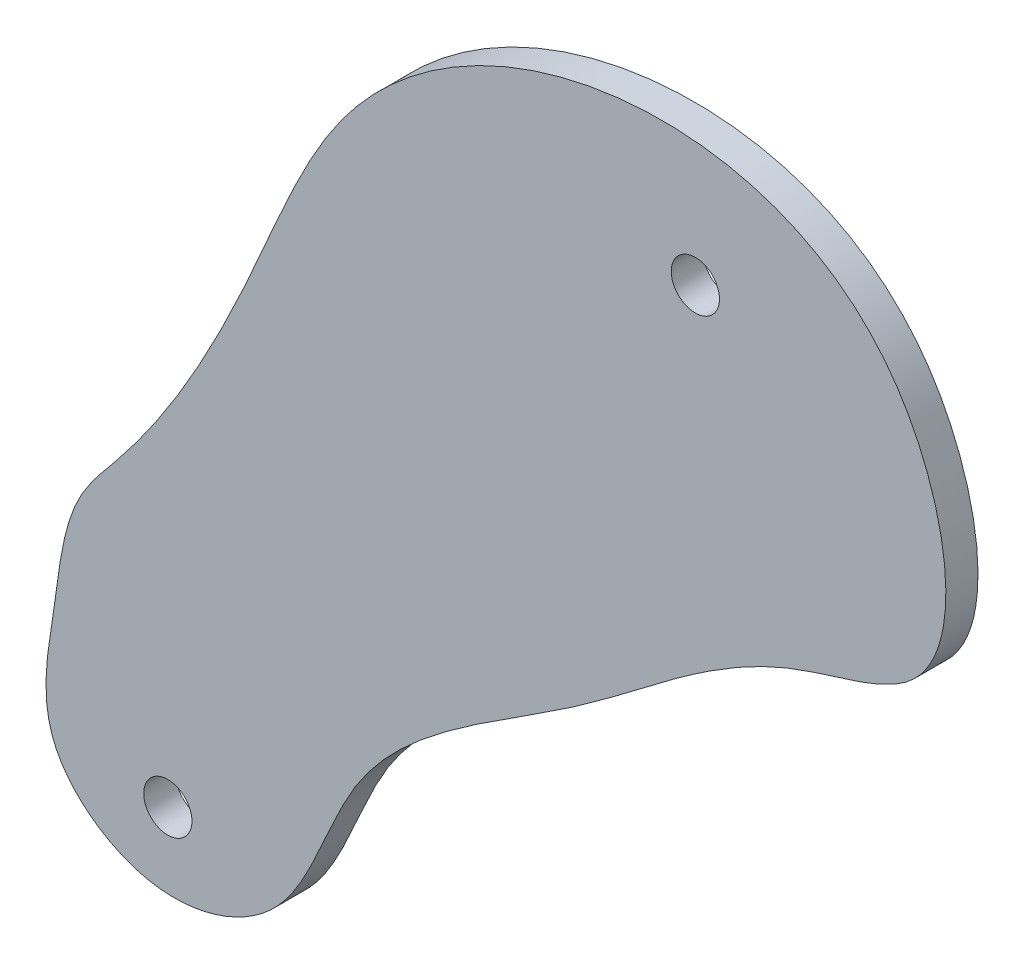
from build123d import *

# Parameters (mm, degrees)
SKETCH1_R           = 1.5875
BOSS_EXTRUDE1_DEPTH = 4.292022727
SCALE1_OUTLINE_R    = 1.5875
SCALE1_OUTLINE_R_2  = 1.174344317
SCALE1_DEPTH        = 4.292022727
SCALE1_START        = 3.733510367
SCALE1_2_OUTLINE_R  = 1.174344317
SCALE1_2_DEPTH      = 0.55851236
SCALE1_3_OUTLINE_R  = 1.174344317
SCALE1_3_DEPTH      = 0.558510367
SCALE1_START_2      = 0.558510367
SCALE1_4_DEPTH      = 3.175
SKETCH2_R           = 2.38125
CUT_EXTRUDE1_DEPTH  = 337.620379009


# Read off the part's stored shape, not the designer's step: Scale1
with BuildPart() as part:
    # Sketch1 → Boss-Extrude1 (new body)
    with BuildSketch(Plane.XY):
        with BuildLine():
            add(Edge.make_bspline(
                [(190.344354414, 117.418149775), (188.736168186, 115.442489975), (183.532463499, 109.548949075), (182.378770249, 96.436274637), (178.951978376, 79.624544906), (195.015083797, 68.012041131), (211.779814408, 73.727153438), (217.56330745, 86.030346742), (225.783899475, 104.934622697), (252.87956814, 118.144097358), (274.040631357, 138.495157903), (305.546390071, 144.248595899), (297.646060912, 190.646179781), (252.059583008, 197.617101997), (220.064148007, 176.74369072), (207.878039078, 145.579422525), (198.163927402, 127.024509865), (190.344354414, 117.418149775)],
                knots=[0, 0, 0, 0, 0.02085959, 0.063862737, 0.106624897, 0.152099283, 0.197954811, 0.233553889, 0.261539966, 0.367580776, 0.464212701, 0.509543331, 0.602655178, 0.727730123, 0.825803478, 0.898573259, 1, 1, 1, 1], degree=3))
        make_face()
        with Locations((197.264574128, 80.831987901)):
            Circle(SKETCH1_R, mode=Mode.SUBTRACT)
        with Locations((267.68045118, 176.402360892)):
            Circle(SKETCH1_R, mode=Mode.SUBTRACT)
    extrude(amount=BOSS_EXTRUDE1_DEPTH)

    # Scale1 outline → Scale1 (cut)
    # profile 1 of 3: a face of its own
    with BuildSketch(Plane.XY):
        with BuildLine():
            add(Edge.make_bspline(
                [(190.344354414, 117.418149775), (188.736168186, 115.442489975), (183.532463499, 109.548949075), (182.378770249, 96.436274637), (178.951978376, 79.624544906), (195.015083797, 68.012041131), (211.779814408, 73.727153438), (217.56330745, 86.030346742), (225.783899475, 104.934622697), (252.87956814, 118.144097358), (274.040631357, 138.495157903), (305.546390071, 144.248595899), (297.646060912, 190.646179781), (252.059583008, 197.617101997), (220.064148007, 176.74369072), (207.878039078, 145.579422525), (198.163927402, 127.024509865), (190.344354414, 117.418149775)],
                knots=[0, 0, 0, 0, 0.02085959, 0.063862737, 0.106624897, 0.152099283, 0.197954811, 0.233553889, 0.261539966, 0.367580776, 0.464212701, 0.509543331, 0.602655178, 0.727730123, 0.825803478, 0.898573259, 1, 1, 1, 1], degree=3))
        make_face()
        with Locations((197.264574128, 80.831987901)):
            Circle(SCALE1_OUTLINE_R, mode=Mode.SUBTRACT)
        with BuildLine():
            add(Edge.make_bspline(
                [(202.929361246, 123.211313888), (201.739714405, 121.749830512), (197.890302734, 117.390116329), (197.036864553, 107.690088164), (194.501914277, 95.253704368), (206.384507393, 86.663419128), (218.78612385, 90.891141749), (223.064430741, 99.992360736), (229.145568083, 113.976693992), (249.189438649, 123.748329585), (264.84321776, 138.802913714), (288.149427972, 143.058987551), (284.024198144, 167.285914442), (273.244441598, 175.273907861), (269.159699864, 176.978537585)],
                knots=[0, 0, 0, 0, 0.02085959, 0.063862737, 0.106624897, 0.152099283, 0.197954811, 0.233553889, 0.261539966, 0.367580776, 0.464212701, 0.509543331, 0.602655178, 0.650220254, 0.650220254, 0.650220254, 0.650220254], degree=3))
            add(Edge.make_bspline(
                [(266.926262901, 177.799270441), (260.792953455, 179.76314812), (244.097426387, 179.611805029), (224.914413668, 167.097053659), (215.899807197, 144.043459164), (208.71384698, 130.317565468), (202.929361246, 123.211313888)],
                knots=[0.658734935, 0.658734935, 0.658734935, 0.658734935, 0.727730123, 0.825803478, 0.898573259, 1, 1, 1, 1], degree=3))
            ThreePointArc((266.926262901, 177.799270441), (268.228017389, 177.892437231), (269.159699864, 176.978537585))
        make_face(mode=Mode.SUBTRACT)
    # profile 2 of 3: a face of its own
    with BuildSketch(Plane.XY):
        with Locations((260.138309761, 166.844556813)):
            Circle(SCALE1_OUTLINE_R_2)
    # profile 3 of 3: a face of its own
    with BuildSketch(Plane.XY):
        with Locations((208.048555385, 96.146903625)):
            Circle(SCALE1_OUTLINE_R_2)
    extrude(amount=SCALE1_DEPTH, mode=Mode.SUBTRACT)

    # Scale1 2 outline → Scale1 2 (cut)
    with BuildSketch(Plane.XY.offset(SCALE1_START)):
        with BuildLine():
            add(Edge.make_bspline(
                [(266.926262901, 177.799270441), (260.792953455, 179.76314812), (244.097426387, 179.611805029), (224.914413668, 167.097053659), (215.899807197, 144.043459164), (207.853346525, 128.673924618), (197.890302734, 117.390116329), (197.036864553, 107.690088164), (194.501914277, 95.253704368), (206.384507393, 86.663419128), (218.78612385, 90.891141749), (223.064430741, 99.992360736), (229.145568083, 113.976693992), (249.189438649, 123.748329585), (264.84321776, 138.802913714), (288.149427972, 143.058987551), (284.024198144, 167.285914442), (273.244441598, 175.273907861), (269.159699864, 176.978537585)],
                knots=[0.658734935, 0.658734935, 0.658734935, 0.658734935, 0.727730123, 0.825803478, 0.898573259, 1, 1.02085959, 1.063862737, 1.106624897, 1.152099283, 1.197954811, 1.233553889, 1.261539966, 1.367580776, 1.464212701, 1.509543331, 1.602655178, 1.650220254, 1.650220254, 1.650220254, 1.650220254], degree=3))
            ThreePointArc((269.159699864, 176.978537585), (267.132884971, 174.912284553), (266.926262901, 177.799270441))
        make_face()
        with Locations((208.048555385, 96.146903625)):
            Circle(SCALE1_2_OUTLINE_R, mode=Mode.SUBTRACT)
        with Locations((260.138309761, 166.844556813)):
            Circle(SCALE1_2_OUTLINE_R, mode=Mode.SUBTRACT)
    extrude(amount=SCALE1_2_DEPTH, mode=Mode.SUBTRACT)

    # Scale1 3 outline → Scale1 3 (cut)
    with BuildSketch(Plane.XY):
        with BuildLine():
            add(Edge.make_bspline(
                [(266.926262901, 177.799270441), (260.792953455, 179.76314812), (244.097426387, 179.611805029), (224.914413668, 167.097053659), (215.899807197, 144.043459164), (207.853346525, 128.673924618), (197.890302734, 117.390116329), (197.036864553, 107.690088164), (194.501914277, 95.253704368), (206.384507393, 86.663419128), (218.78612385, 90.891141749), (223.064430741, 99.992360736), (229.145568083, 113.976693992), (249.189438649, 123.748329585), (264.84321776, 138.802913714), (288.149427972, 143.058987551), (284.024198144, 167.285914442), (273.244441598, 175.273907861), (269.159699864, 176.978537585)],
                knots=[0.658734935, 0.658734935, 0.658734935, 0.658734935, 0.727730123, 0.825803478, 0.898573259, 1, 1.02085959, 1.063862737, 1.106624897, 1.152099283, 1.197954811, 1.233553889, 1.261539966, 1.367580776, 1.464212701, 1.509543331, 1.602655178, 1.650220254, 1.650220254, 1.650220254, 1.650220254], degree=3))
            ThreePointArc((269.159699864, 176.978537585), (267.132884971, 174.912284553), (266.926262901, 177.799270441))
        make_face()
        with Locations((208.048555385, 96.146903625)):
            Circle(SCALE1_3_OUTLINE_R, mode=Mode.SUBTRACT)
        with Locations((260.138309761, 166.844556813)):
            Circle(SCALE1_3_OUTLINE_R, mode=Mode.SUBTRACT)
    extrude(amount=SCALE1_3_DEPTH, mode=Mode.SUBTRACT)

    # Scale1 4 outline → Scale1 4 (add)
    with BuildSketch(Plane.XY.offset(SCALE1_START_2)):
        with BuildLine():
            ThreePointArc((266.926262901, 177.799270441), (267.132884971, 174.912284553), (269.159699864, 176.978537585))
            add(Edge.make_bspline(
                [(269.159699864, 176.978537585), (268.428485428, 177.283685363), (267.683173216, 177.556908747), (266.926262901, 177.799270441)],
                knots=[0.650220254, 0.650220254, 0.650220254, 0.650220254, 0.658734935, 0.658734935, 0.658734935, 0.658734935], degree=3))
        make_face()
    extrude(amount=SCALE1_4_DEPTH)

    # Sketch2 → Cut-Extrude1 (cut, through all)
    with BuildSketch(Plane.XY.offset(3.733510367)):
        with Locations((260.138309761, 166.844556813)):
            Circle(SKETCH2_R)
        with Locations((208.048555385, 96.146903625)):
            Circle(SKETCH2_R)
    extrude(amount=-CUT_EXTRUDE1_DEPTH, mode=Mode.SUBTRACT)


solid = part.part
